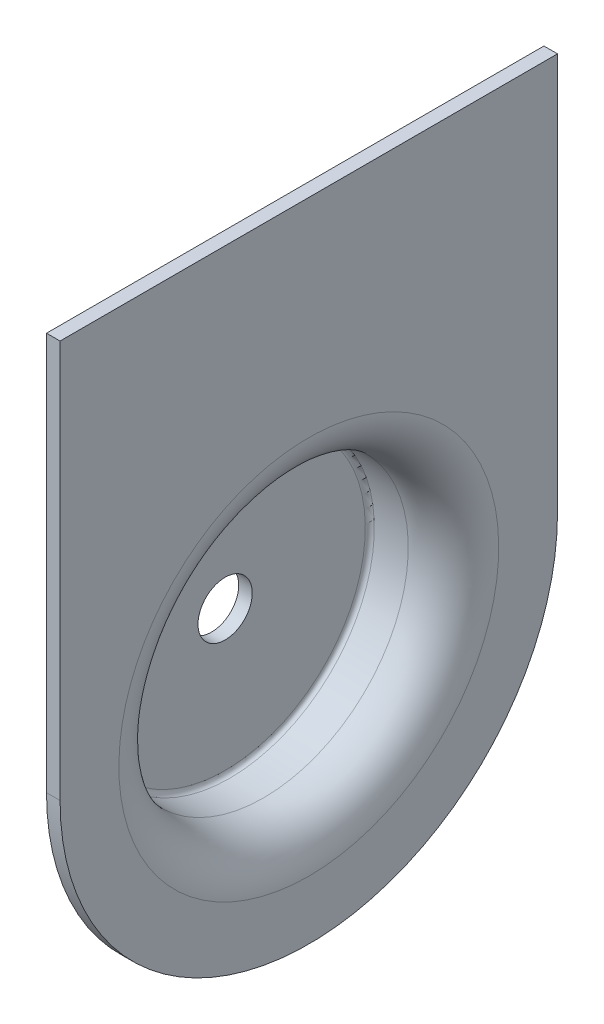
from build123d import *

# Parameters (mm, degrees)
MOTOR_RING_DEPTH      = 12.5
MOTOR_RING_DEPTH_BACK = 6
SKETCH1_R             = 35
SKETCH1_R_2           = 32
SKETCH3_R             = 35
SKETCH3_R_2           = 6
MOTOR_CAP_DEPTH       = 3
BULK_START            = 3
SKETCH2_R             = 32
BULK_EXTRUDE_DEPTH    = 3
FILLET2_R             = 10
FILLET3_R             = 10
FILLET4_R             = 3
FILLET5_R             = 1


with BuildPart() as part:
    # Sketch1 → MOTOR RING (new, two sides: drawn at the far end of the back side and taken through both)
    with BuildSketch(Plane(origin=(-42.5, 0, 0), x_dir=(0, 0, -1), z_dir=(1, 0, 0)).offset(-MOTOR_RING_DEPTH_BACK)):
        with Locations(Location((50, -18.372727273, 0), (0, 0, 270))):
            Circle(SKETCH1_R)
        with Locations(Location((50, -18.372727273, 0), (0, 0, 270))):
            Circle(SKETCH1_R_2, mode=Mode.SUBTRACT)
    extrude(amount=MOTOR_RING_DEPTH + MOTOR_RING_DEPTH_BACK)

    # Sketch3 → MOTOR CAP (add)
    with BuildSketch(Plane(origin=(-48.5, 0, 0), x_dir=(0, 0, -1), z_dir=(1, 0, 0))):
        with Locations(Location((50, -18.372727273, 0), (0, 0, 270))):
            Circle(SKETCH3_R)
        with Locations(Location((50, -18.372727273, 0), (0, 0, 90))):
            Circle(SKETCH3_R_2, mode=Mode.SUBTRACT)
    extrude(amount=-MOTOR_CAP_DEPTH)

    # Sketch2 → BULK EXTRUDE (add)
    with BuildSketch(Plane.ZY.offset(27).offset(BULK_START)):
        with BuildLine():
            Line((-105, -18.372727273), (-105, 69.627272727))
            Line((-105, 69.627272727), (5, 69.627272727))
            Line((5, 69.627272727), (5, -18.372727273))
            ThreePointArc((5, -18.372727273), (-50, -73.372727273), (-105, -18.372727273))
        make_face()
        with Locations(Location((-50, -18.372727273, 0), (0, 0, 270))):
            Circle(SKETCH2_R, mode=Mode.SUBTRACT)
    extrude(amount=BULK_EXTRUDE_DEPTH)

    # Fillet2
    # the kernel refuses this fillet: 10 mm, written as the material it adds along each edge
    with BuildSketch(Plane(origin=(-33, -18.372727273, -50), x_dir=(0, -1, 0), z_dir=(0, 0, -1))) as fillet2_piece_1:
        with BuildLine():
            CenterArc((35 + FILLET2_R, FILLET2_R), FILLET2_R, 180, 90)
            Line((35 + FILLET2_R, 0), (35, 0))
            Line((35, 0), (35, FILLET2_R))
        make_face()
    revolve(axis=Axis((-33, -18.372727273, -50), (-1, 0, 0)))

    # Fillet3
    fillet3_edges = [part.edges().sort_by_distance(p)[0] for p in [
        (-30, 13.627272727, -50),
    ]]
    fillet(fillet3_edges, radius=FILLET3_R)

    # Fillet4
    fillet4_edges = [part.edges().sort_by_distance(p)[0] for p in [
        (-51.5, 16.627272727, -50),
    ]]
    fillet(fillet4_edges, radius=FILLET4_R)

    # Fillet5
    fillet5_edges = [part.edges().sort_by_distance(p)[0] for p in [
        (-48.5, 13.627272727, -50),
    ]]
    fillet(fillet5_edges, radius=FILLET5_R)


solid = part.part
